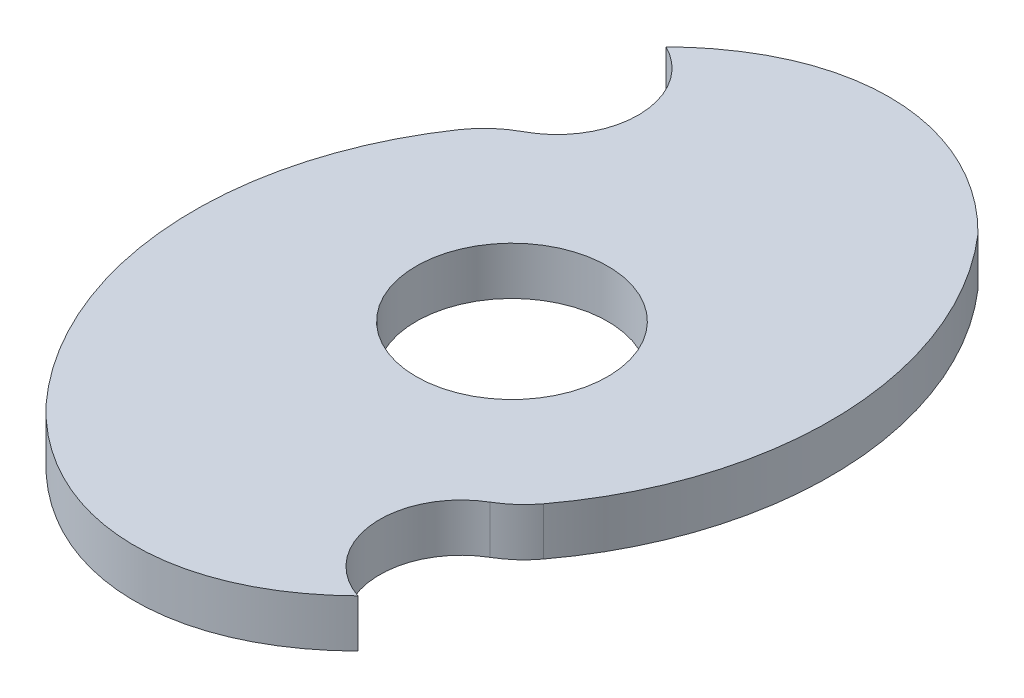
from build123d import *

# Parameters (mm, degrees)
SKETCH2_R           = 20
BOSS_EXTRUDE1_DEPTH = 10


with BuildPart() as part:
    # Sketch2 → Boss-Extrude1 (new body)
    with BuildSketch(Plane(origin=(0, 0, 0), x_dir=(1, 0, 0), z_dir=(0, 1, 0))):
        with BuildLine():
            add(Edge.make_bspline(
                [(32.890816776, 64.434382991), (32.24160743, 65.09226101), (31.579970408, 65.725048917)],
                knots=[2.486473007, 2.486473007, 2.486473007, 2.515885359, 2.515885359, 2.515885359], degree=2, weights=[0.995485519, 0.991130099, 0.986983954]))
            add(Edge.make_bspline(
                [(31.579970408, 65.725048917), (-1.461093219, 97.32543524), (-33.553455907, 65.73154311)],
                knots=[2.515885359, 2.515885359, 2.515885359, 3.725790636, 3.725790636, 3.725790636], degree=2, weights=[0.986983954, 0.81642831, 1]))
            ThreePointArc((-33.553455907, 65.73154311), (-24.106363303, 50.74893711), (-33.111774894, 35.496769943))
            ThreePointArc((-33.111774894, 35.496769943), (-37.065719465, 32.73091061), (-40.242152403, 29.098565734))
            ThreePointArc((-40.242152403, 29.098565734), (-53.046853402, -18.49454868), (-33.547859274, -63.758818643))
            add(Edge.make_bspline(
                [(-33.547859274, -63.758818643), (-32.578203378, -64.77034153), (-31.579970408, -65.725048917)],
                knots=[5.613007617, 5.613007617, 5.613007617, 5.657478013, 5.657478013, 5.657478013], degree=2, weights=[1, 0.993252773, 0.986983954]))
            add(Edge.make_bspline(
                [(-31.579970408, -65.725048917), (1.461093219, -97.32543524), (33.553455907, -65.73154311)],
                knots=[5.657478013, 5.657478013, 5.657478013, 6.867383289, 6.867383289, 6.867383289], degree=2, weights=[0.986983954, 0.81642831, 1]))
            ThreePointArc((33.553455907, -65.73154311), (22.097044724, -51.365796168), (30.397126491, -34.972727965))
            ThreePointArc((30.397126491, -34.972727965), (33.593873743, -32.640715353), (36.268934638, -29.724977876))
            ThreePointArc((36.268934638, -29.724977876), (51.211222005, 17.95137874), (32.890816776, 64.434382991))
        make_face()
        Circle(SKETCH2_R, mode=Mode.SUBTRACT)
    extrude(amount=BOSS_EXTRUDE1_DEPTH)


solid = part.part
